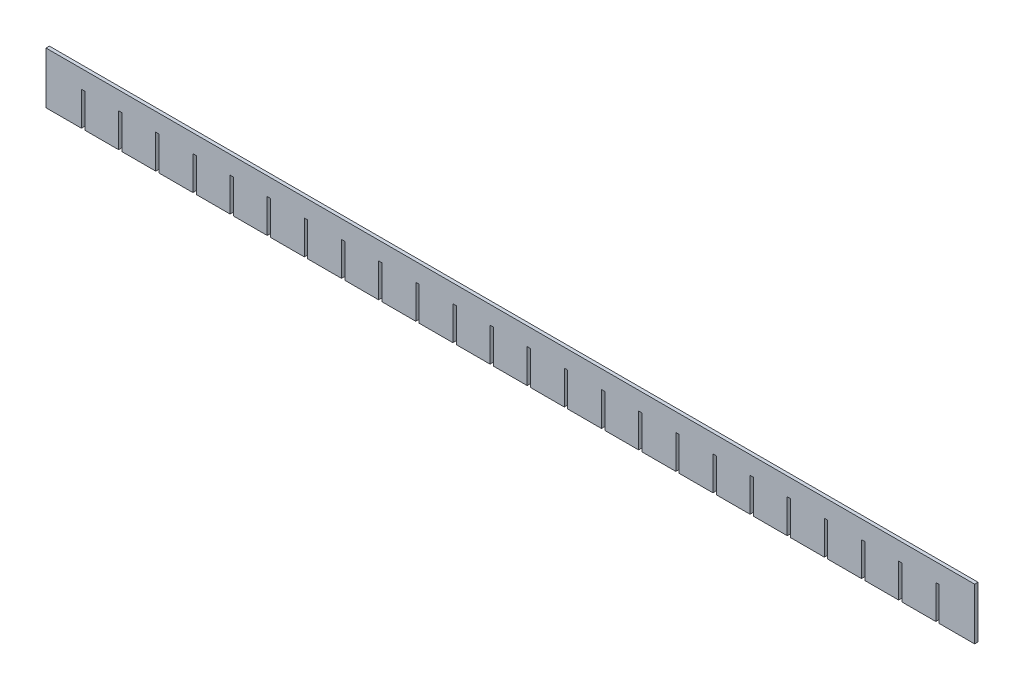
from build123d import *

# Parameters (mm, degrees)
SKETCH1_W           = 825
SKETCH1_H           = 46
BOSS_EXTRUDE1_DEPTH = 3
SKETCH2_W           = 3
SKETCH2_H           = 30
CUT_EXTRUDE1_DEPTH  = 414.151606556
LPATTERN1_COUNT     = 24
LPATTERN1_PITCH     = 33


with BuildPart() as part:
    # Sketch1 → Boss-Extrude1 (new body)
    with BuildSketch(Plane.XY):
        Rectangle(SKETCH1_W, SKETCH1_H)
    extrude(amount=BOSS_EXTRUDE1_DEPTH)

    # Sketch2 → Cut-Extrude1 (cut, through all)
    with BuildSketch(Plane.XY.offset(3)):
        with Locations((-379.5, -8)):
            Rectangle(SKETCH2_W, SKETCH2_H)
    cut_extrude1 = extrude(amount=-CUT_EXTRUDE1_DEPTH, mode=Mode.SUBTRACT)

    # LPattern1: Cut-Extrude1 ×24
    with Locations(*[(i * LPATTERN1_PITCH, 0, 0) for i in range(1, LPATTERN1_COUNT)]):
        add(cut_extrude1, mode=Mode.SUBTRACT)


solid = part.part
